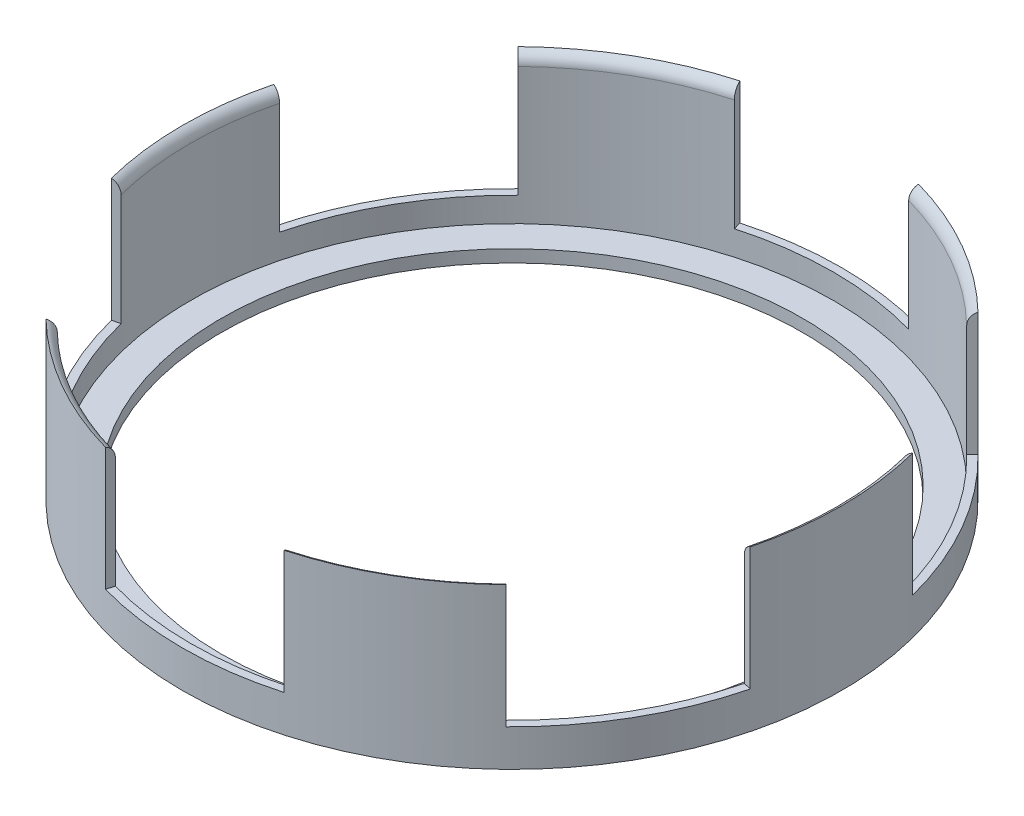
from build123d import *

# Parameters (mm, degrees)
SKETCH1_R                = 26.125
BOSS_EXTRUDE1_DEPTH      = 1
SKETCH2_W                = 0.65
SKETCH2_H                = 3
CUT_EXTRUDE2_DEPTH       = 38.984224
CUT_EXTRUDE2_DEPTH_BACK  = 38.984224
SKETCH3_R                = 23.625
BOSS_EXTRUDE2_DEPTH      = 13
FILLET1_R                = 1
CIRPATTERN1_COUNT        = 6
FILLET1_OF_CIRPATTERN1_R = 1


with BuildPart() as part:
    # Sketch1 → Boss-Extrude1 (new body)
    with BuildSketch(Plane(origin=(0, 0, 0), x_dir=(1, 0, 0), z_dir=(0, 1, 0))):
        with Locations(Location((0, 0, 0), (0, 0, 270))):
            Circle(SKETCH1_R)
    extrude(amount=BOSS_EXTRUDE1_DEPTH)

    # Sketch2 → Revolve1 (revolve)
    with BuildSketch(Plane.XY, mode=Mode.PRIVATE) as revolve1_sk:
        with Locations((26.45, 1.5)):
            Rectangle(SKETCH2_W, SKETCH2_H)
    revolve(revolve1_sk.sketch.rotate(Axis((0, 0, 0), (0, 1, 0)), 90), axis=Axis((0, 0, 0), (0, 1, 0)))

    # Sketch3 → Cut-Extrude2 (cut, two sides: drawn at the far end of the back side and taken through both)
    with BuildSketch(Plane(origin=(0, 0, 0), x_dir=(1, 0, 0), z_dir=(0, 1, 0)).offset(-CUT_EXTRUDE2_DEPTH_BACK)):
        with Locations(Location((0, 0, 0), (0, 0, 270))):
            Circle(SKETCH3_R)
    extrude(amount=CUT_EXTRUDE2_DEPTH + CUT_EXTRUDE2_DEPTH_BACK, mode=Mode.SUBTRACT)

    # Sketch5 → Boss-Extrude2 (add)
    with BuildSketch(Plane(origin=(0, 0, 0), x_dir=(1, 0, 0), z_dir=(0, 1, 0))):
        with BuildLine():
            Line((25.948808, 6.6), (25.318865, 6.439776))
            ThreePointArc((25.318865, 6.439776), (26.125, 0), (25.318865, -6.439776))
            Line((25.318865, -6.439776), (25.948808, -6.6))
            ThreePointArc((25.948808, -6.6), (26.775, 0), (25.948808, 6.6))
        make_face()
    boss_extrude2 = extrude(amount=BOSS_EXTRUDE2_DEPTH)

    # Fillet1
    # the kernel refuses this fillet: 1 mm, written as the material it takes off along each edge
    with BuildSketch(Plane(origin=(0, 13, 0), x_dir=(0.9431839321448116, 0, -0.33227107930701955), z_dir=(-0.33227107930701955, 0, -0.9431839321448116))) as fillet1_piece_1:
        with BuildLine():
            CenterArc((27.125, 0.93675), FILLET1_R, 180, 69.512685)
            Line((26.125, 0.93675), (26.105, 0.93675))
            Line((26.105, 0.93675), (26.105, 0))
            Line((26.105, 0), (26.125, -0.02))
            ThreePointArc((26.125, -0.02), (26.45, -0.02), (26.768, -0.018735))
            Line((26.768, -0.018735), (26.775, 0))
        make_face()
    revolve(axis=Axis((0, 13, 0), (0, -1, 0)), revolution_arc=38.813358, mode=Mode.SUBTRACT)

    # CirPattern1: Boss-Extrude2 ×6 about axis
    cirpattern1_axis = Axis((0, 0, 0), (0, 1, 0))
    for i in range(1, CIRPATTERN1_COUNT):
        add(boss_extrude2.rotate(cirpattern1_axis, i * 360 / CIRPATTERN1_COUNT))

    # Fillet1 of CirPattern1
    # the kernel refuses this fillet: 1 mm, written as the material it takes off along each edge
    with BuildSketch(Plane(origin=(0, 13, 0), x_dir=(0.18383677044965302, 0, -0.9829567853322146), z_dir=(-0.9829567853322146, 0, -0.18383677044965302))) as fillet1_of_cirpattern1_piece_1:
        with BuildLine():
            CenterArc((27.125, 0.93675), FILLET1_OF_CIRPATTERN1_R, 180, 69.512685)
            Line((26.125, 0.93675), (26.105, 0.93675))
            Line((26.105, 0.93675), (26.105, 0))
            Line((26.105, 0), (26.125, -0.02))
            ThreePointArc((26.125, -0.02), (26.45, -0.02), (26.768, -0.018735))
            Line((26.768, -0.018735), (26.775, 0))
        make_face()
    revolve(axis=Axis((0, 13, 0), (0, -1, 0)), revolution_arc=38.813358, mode=Mode.SUBTRACT)
    with BuildSketch(Plane(origin=(0, 13, 0), x_dir=(-0.7593471616951585, 0, -0.6506857060251953), z_dir=(-0.6506857060251953, 0, 0.7593471616951585))) as fillet1_of_cirpattern1_piece_2:
        with BuildLine():
            CenterArc((27.125, 0.93675), FILLET1_OF_CIRPATTERN1_R, 180, 69.512685)
            Line((26.125, 0.93675), (26.105, 0.93675))
            Line((26.105, 0.93675), (26.105, 0))
            Line((26.105, 0), (26.125, -0.02))
            ThreePointArc((26.125, -0.02), (26.45, -0.02), (26.768, -0.018735))
            Line((26.768, -0.018735), (26.775, 0))
        make_face()
    revolve(axis=Axis((0, 13, 0), (0, -1, 0)), revolution_arc=38.813358, mode=Mode.SUBTRACT)
    with BuildSketch(Plane(origin=(0, 13, 0), x_dir=(-0.9431839321448114, 0, 0.3322710793070194), z_dir=(0.3322710793070194, 0, 0.9431839321448114))) as fillet1_of_cirpattern1_piece_3:
        with BuildLine():
            CenterArc((27.125, 0.93675), FILLET1_OF_CIRPATTERN1_R, 180, 69.512685)
            Line((26.125, 0.93675), (26.105, 0.93675))
            Line((26.105, 0.93675), (26.105, 0))
            Line((26.105, 0), (26.125, -0.02))
            ThreePointArc((26.125, -0.02), (26.45, -0.02), (26.768, -0.018735))
            Line((26.768, -0.018735), (26.775, 0))
        make_face()
    revolve(axis=Axis((0, 13, 0), (0, -1, 0)), revolution_arc=38.813358, mode=Mode.SUBTRACT)
    with BuildSketch(Plane(origin=(0, 13, 0), x_dir=(-0.18383677044965369, 0, 0.9829567853322146), z_dir=(0.9829567853322146, 0, 0.18383677044965369))) as fillet1_of_cirpattern1_piece_4:
        with BuildLine():
            CenterArc((27.125, 0.93675), FILLET1_OF_CIRPATTERN1_R, 180, 69.512685)
            Line((26.125, 0.93675), (26.105, 0.93675))
            Line((26.105, 0.93675), (26.105, 0))
            Line((26.105, 0), (26.125, -0.02))
            ThreePointArc((26.125, -0.02), (26.45, -0.02), (26.768, -0.018735))
            Line((26.768, -0.018735), (26.775, 0))
        make_face()
    revolve(axis=Axis((0, 13, 0), (0, -1, 0)), revolution_arc=38.813358, mode=Mode.SUBTRACT)
    with BuildSketch(Plane(origin=(0, 13, 0), x_dir=(0.7593471616951586, 0, 0.6506857060251952), z_dir=(0.6506857060251952, 0, -0.7593471616951586))) as fillet1_of_cirpattern1_piece_5:
        with BuildLine():
            CenterArc((27.125, 0.93675), FILLET1_OF_CIRPATTERN1_R, 180, 69.512685)
            Line((26.125, 0.93675), (26.105, 0.93675))
            Line((26.105, 0.93675), (26.105, 0))
            Line((26.105, 0), (26.125, -0.02))
            ThreePointArc((26.125, -0.02), (26.45, -0.02), (26.768, -0.018735))
            Line((26.768, -0.018735), (26.775, 0))
        make_face()
    revolve(axis=Axis((0, 13, 0), (0, -1, 0)), revolution_arc=38.813358, mode=Mode.SUBTRACT)


solid = part.part
